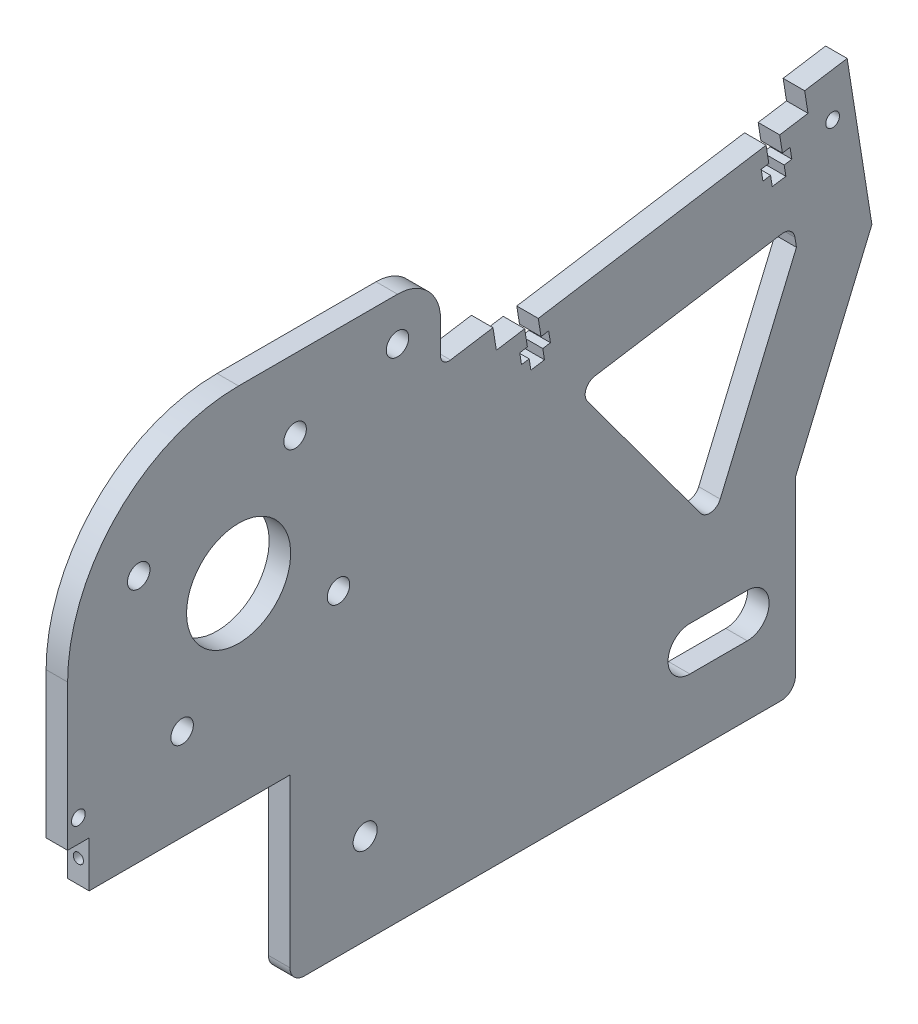
from build123d import *

# Parameters (mm, degrees)
SKETCH1_R           = 2.4892
SKETCH1_R_2         = 2.667
SKETCH1_R_3         = 1.524
SKETCH1_R_4         = 11.522750336
BOSS_EXTRUDE1_DEPTH = 4.7625
SKETCH2_R           = 1.1303
CUT_EXTRUDE1_DEPTH  = 6.35


with BuildPart() as part:
    # Sketch1 → Boss-Extrude1 (new body)
    with BuildSketch(Plane(origin=(0, 0, 0), x_dir=(0, 0, -1), z_dir=(1, 0, 0))):
        with BuildLine():
            Line((-28.170295117, 0), (77.382795117, 0))
            ThreePointArc((77.382795117, 0), (79.627859148, 0.92993597), (80.557795117, 3.175))
            Line((80.557795117, 3.175), (80.557795117, 41.307035595))
            Line((80.557795117, 41.307035595), (97.47645297, 81.253872056))
            Line((97.47645297, 81.253872056), (92.000706017, 115.826377673))
            Line((92.000706017, 115.826377673), (82.592974573, 114.336339393))
            Line((82.592974573, 114.336339393), (83.337993713, 109.632473671))
            Line((83.337993713, 109.632473671), (77.06617275, 108.639114818))
            Line((77.06617275, 108.639114818), (77.667154856, 104.844663135))
            Line((77.667154856, 104.844663135), (79.360546516, 105.112870026))
            Line((79.360546516, 105.112870026), (79.752923263, 102.635500745))
            Line((79.752923263, 102.635500745), (78.059531603, 102.367293855))
            Line((78.059531603, 102.367293855), (78.432041173, 100.015360994))
            Line((78.432041173, 100.015360994), (75.421567111, 99.538548745))
            Line((75.421567111, 99.538548745), (75.049057541, 101.890481606))
            Line((75.049057541, 101.890481606), (73.355665881, 101.622274715))
            Line((73.355665881, 101.622274715), (72.963289134, 104.099643996))
            Line((72.963289134, 104.099643996), (74.656680794, 104.367850886))
            Line((74.656680794, 104.367850886), (74.055698688, 108.162302569))
            Line((74.055698688, 108.162302569), (23.630258147, 100.17569739))
            Line((23.630258147, 100.17569739), (24.231240253, 96.381245708))
            Line((24.231240253, 96.381245708), (25.924631913, 96.649452598))
            Line((25.924631913, 96.649452598), (26.31700866, 94.172083318))
            Line((26.31700866, 94.172083318), (24.623617, 93.903876428))
            Line((24.623617, 93.903876428), (24.99612657, 91.551943567))
            Line((24.99612657, 91.551943567), (21.985652508, 91.075131317))
            Line((21.985652508, 91.075131317), (21.613142938, 93.427064178))
            Line((21.613142938, 93.427064178), (19.919751278, 93.158857288))
            Line((19.919751278, 93.158857288), (19.527374531, 95.636226568))
            Line((19.527374531, 95.636226568), (21.220766191, 95.904433458))
            Line((21.220766191, 95.904433458), (20.619784085, 99.698885141))
            Line((20.619784085, 99.698885141), (14.347963122, 98.705526288))
            Line((14.347963122, 98.705526288), (13.602943983, 103.40939201))
            Line((13.602943983, 103.40939201), (4.195212538, 101.91935373))
            ThreePointArc((4.195212538, 101.91935373), (2.66000635, 102.352326655), (1.992204883, 103.800900019))
            Line((1.992204883, 103.800900019), (1.992204883, 110.875))
            ThreePointArc((1.992204883, 110.875), (-0.797603027, 117.610192091), (-7.532795117, 120.4))
            Line((-7.532795117, 120.4), (-42.707795117, 120.4))
            ThreePointArc((-42.707795117, 120.4), (-69.471786785, 109.313991668), (-80.557795117, 82.55))
            Line((-80.557795117, 82.55), (-80.557795117, 50.292))
            Line((-80.557795117, 50.292), (-75.795295117, 50.292))
            Line((-75.795295117, 50.292), (-75.795295117, 40.132))
            Line((-75.795295117, 40.132), (-31.345295117, 40.132))
            Line((-31.345295117, 40.132), (-31.345295117, 3.175))
            ThreePointArc((-31.345295117, 3.175), (-30.415359148, 0.92993597), (-28.170295117, 0))
        make_face()
        with Locations((-55.209041359, 60.43939525)):
            Circle(SKETCH1_R, mode=Mode.SUBTRACT)
        with Locations((-14.692204883, 20.066)):
            Circle(SKETCH1_R_2, mode=Mode.SUBTRACT)
        with Locations((-20.597190367, 70.048753759)):
            Circle(SKETCH1_R, mode=Mode.SUBTRACT)
        with Locations((-64.818399868, 95.051246241)):
            Circle(SKETCH1_R, mode=Mode.SUBTRACT)
        with Locations((-30.206548876, 104.66060475)):
            Circle(SKETCH1_R, mode=Mode.SUBTRACT)
        with Locations((-78.176545117, 55.372)):
            Circle(SKETCH1_R_3, mode=Mode.SUBTRACT)
        with Locations((-42.707795117, 82.55)):
            Circle(SKETCH1_R_4, mode=Mode.SUBTRACT)
        with Locations((-7.532795117, 110.875)):
            Circle(SKETCH1_R, mode=Mode.SUBTRACT)
        with Locations((88.786878575, 105.673627089)):
            Circle(SKETCH1_R_3, mode=Mode.SUBTRACT)
        with BuildLine():
            Line((69.889795117, 15.2273), (57.189795117, 15.2273))
            ThreePointArc((57.189795117, 15.2273), (52.351095117, 20.066), (57.189795117, 24.9047))
            Line((57.189795117, 24.9047), (69.889795117, 24.9047))
            ThreePointArc((69.889795117, 24.9047), (74.728495117, 20.066), (69.889795117, 15.2273))
        make_face(mode=Mode.SUBTRACT)
        with BuildLine():
            Line((80.44359285, 87.314923545), (80.774519188, 85.225536877))
            Line((80.774519188, 85.225536877), (63.905732826, 45.396452563))
            ThreePointArc((63.905732826, 45.396452563), (61.863545391, 43.864422793), (59.521631273, 44.880829698))
            Line((59.521631273, 44.880829698), (34.500615909, 78.855996716))
            ThreePointArc((34.500615909, 78.855996716), (34.19606201, 81.326640718), (36.148497, 82.870930999))
            Line((36.148497, 82.870930999), (77.537520924, 89.426308388))
            ThreePointArc((77.537520924, 89.426308388), (79.427839006, 88.972483169), (80.44359285, 87.314923545))
        make_face(mode=Mode.SUBTRACT)
    extrude(amount=BOSS_EXTRUDE1_DEPTH)

    # Sketch2 → Cut-Extrude1 (cut)
    with BuildSketch(Plane.XY.offset(75.795295117)):
        with Locations((2.38125, 45.212)):
            Circle(SKETCH2_R)
    extrude(amount=-CUT_EXTRUDE1_DEPTH, mode=Mode.SUBTRACT)


solid = part.part
